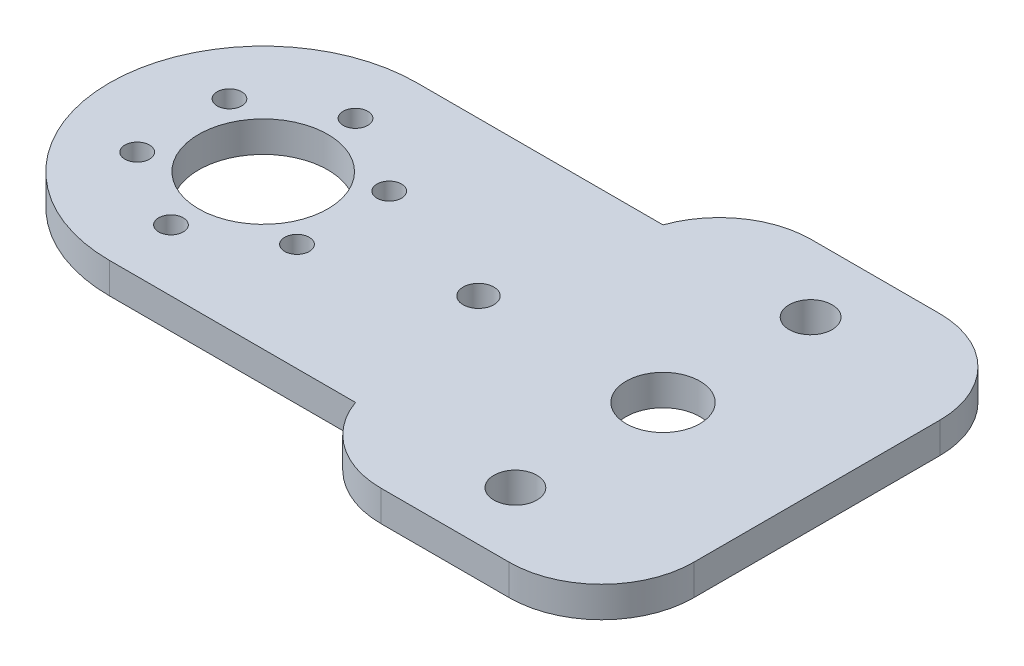
from build123d import *

# Parameters (mm, degrees)
SKETCH1_R           = 3.5
SKETCH1_R_2         = 6
SKETCH1_R_3         = 2.5
SKETCH1_R_4         = 2
SKETCH1_R_5         = 10.5
BOSS_EXTRUDE1_DEPTH = 5
FILLET2_R           = 15


with BuildPart() as part:
    # Sketch1 → Boss-Extrude1 (new body)
    with BuildSketch(Plane(origin=(0, 0, 0), x_dir=(1, 0, 0), z_dir=(0, 1, 0))):
        with BuildLine():
            Line((40, -25), (40, -35))
            Line((40, -35), (90, -35))
            Line((90, -35), (90, 35))
            Line((90, 35), (40, 35))
            Line((40, 35), (40, 25))
            Line((40, 25), (0, 25))
            ThreePointArc((0, 25), (-25, 0), (0, -25))
            Line((0, -25), (40, -25))
        make_face()
        with Locations(Location((65, 24, 0), (0, 0, 270))):
            Circle(SKETCH1_R, mode=Mode.SUBTRACT)
        with Locations(Location((65, -24, 0), (0, 0, 270))):
            Circle(SKETCH1_R, mode=Mode.SUBTRACT)
        with Locations(Location((65, 0, 0), (0, 0, 270))):
            Circle(SKETCH1_R_2, mode=Mode.SUBTRACT)
        with Locations(Location((35, 0, 0), (0, 0, 270))):
            Circle(SKETCH1_R_3, mode=Mode.SUBTRACT)
        with Locations(Location((0, -15, 0), (0, 0, 270))):
            Circle(SKETCH1_R_4, mode=Mode.SUBTRACT)
        with Locations(Location((-12.990381057, -7.5, 0), (0, 0, 270))):
            Circle(SKETCH1_R_4, mode=Mode.SUBTRACT)
        with Locations(Location((12.990381057, -7.5, 0), (0, 0, 270))):
            Circle(SKETCH1_R_4, mode=Mode.SUBTRACT)
        with Locations(Location((-12.990381057, 7.5, 0), (0, 0, 270))):
            Circle(SKETCH1_R_4, mode=Mode.SUBTRACT)
        with Locations(Location((0, 0, 0), (0, 0, 270))):
            Circle(SKETCH1_R_5, mode=Mode.SUBTRACT)
        with Locations(Location((0, 15, 0), (0, 0, 270))):
            Circle(SKETCH1_R_4, mode=Mode.SUBTRACT)
        with Locations(Location((12.990381057, 7.5, 0), (0, 0, 270))):
            Circle(SKETCH1_R_4, mode=Mode.SUBTRACT)
    extrude(amount=BOSS_EXTRUDE1_DEPTH)

    # Fillet2
    # the kernel refuses this fillet: 15 mm, written as the material it takes off along each edge
    with BuildSketch(Plane(origin=(40, -35.355339059, -35), x_dir=(1, 0, 0), z_dir=(0, 1, 0))) as fillet2_piece_1:
        with BuildLine():
            CenterArc((14.142135624, -15), FILLET2_R, 90, 70.528779366)
            Line((0, -10), (-0.282842712, -9.9))
            ThreePointArc((-0.282842712, -9.9), (-0.3, -5), (-0.3, 0))
            Line((-0.3, 0), (0, 0.3))
            Line((0, 0.3), (14.142135624, 0.3))
            Line((14.142135624, 0.3), (14.142135624, 0))
        make_face()
    extrude(amount=75.710678119, mode=Mode.SUBTRACT)
    with BuildSketch(Plane(origin=(90, -37.5, 35), x_dir=(-1, 0, 0), z_dir=(0, 1, 0)), Plane(origin=(90, -37.5, -35), x_dir=(0, 0, 1), z_dir=(0, 1, 0))) as fillet2_piece_2:
        with BuildLine():
            CenterArc((FILLET2_R, -FILLET2_R), FILLET2_R, 90, 90)
            Line((0, -FILLET2_R), (-FILLET2_R * 0.02, -FILLET2_R))
            Line((-FILLET2_R * 0.02, -FILLET2_R), (-FILLET2_R * 0.02, FILLET2_R * 0.02))
            Line((-FILLET2_R * 0.02, FILLET2_R * 0.02), (FILLET2_R, FILLET2_R * 0.02))
            Line((FILLET2_R, FILLET2_R * 0.02), (FILLET2_R, 0))
        make_face()
    extrude(amount=80, mode=Mode.SUBTRACT)
    with BuildSketch(Plane(origin=(40, -35.355339059, 35), x_dir=(0, 0, -1), z_dir=(0, 1, 0))) as fillet2_piece_3:
        with BuildLine():
            CenterArc((15, -14.142135624), FILLET2_R, 109.471220634, 70.528779366)
            Line((0, -14.142135624), (-0.3, -14.142135624))
            Line((-0.3, -14.142135624), (-0.3, 0))
            Line((-0.3, 0), (0, 0.3))
            ThreePointArc((0, 0.3), (5, 0.3), (9.9, 0.282842712))
            Line((9.9, 0.282842712), (10, 0))
        make_face()
    extrude(amount=75.710678119, mode=Mode.SUBTRACT)


solid = part.part
